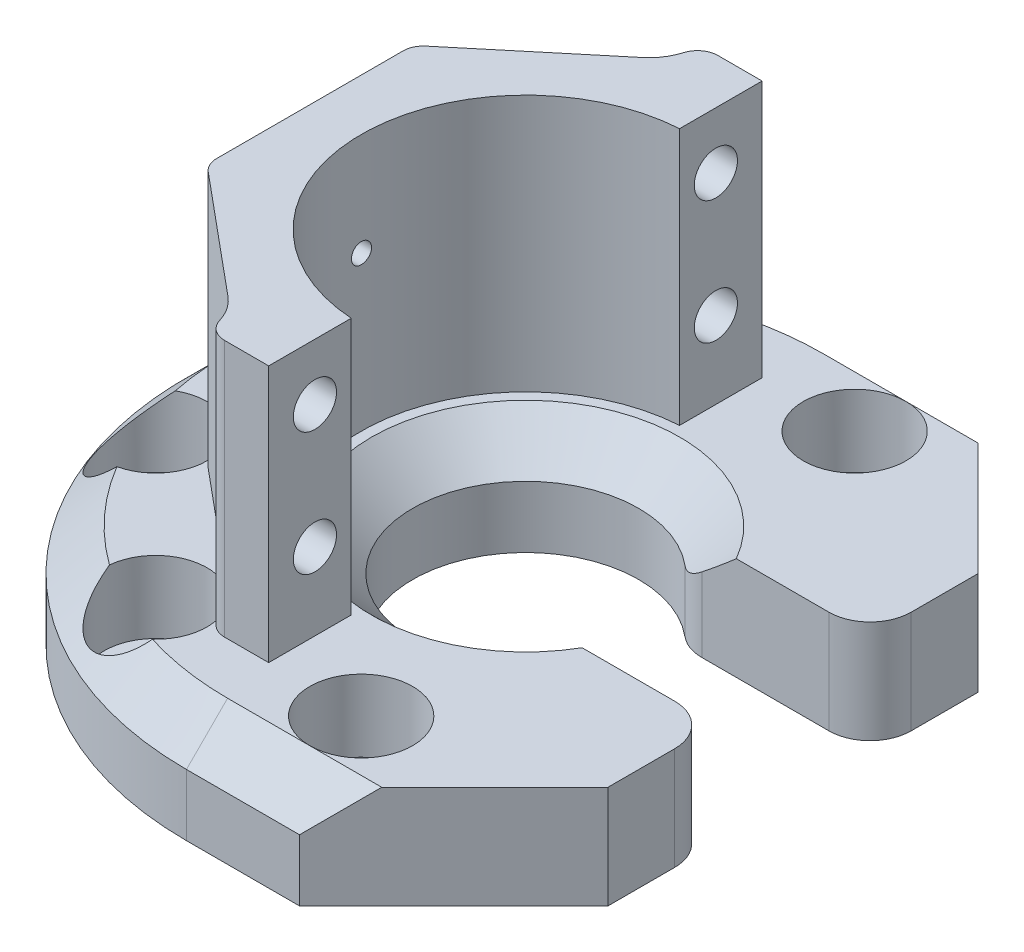
from build123d import *
from build123d.topology import SkipClean

# Parameters (mm, degrees)
SKETCH1_R                      = 33
BOSS_EXTRUDE1_DEPTH            = 5
SKETCH2_R                      = 11
CUT_EXTRUDE1_DEPTH             = 48.728398255
BOSS_EXTRUDE4_DEPTH            = 10
CHAMFER1_SIZE                  = 4
CBORE_FOR_M5_SHCS1_D           = 5.3
CBORE_FOR_M5_SHCS1_CBORE_D     = 10
CBORE_FOR_M5_SHCS1_CBORE_DEPTH = 7
CUT_EXTRUDE12_DEPTH            = 48.728398393
SKETCH43_W                     = 35.90652306
SKETCH43_H                     = 15
CUT_EXTRUDE13_DEPTH            = 48.728398393
FILLET1_R                      = 4
BOSS_EXTRUDE5_START            = 25
BOSS_EXTRUDE5_DEPTH            = 25
SKETCH45_W                     = 4.982753492
SKETCH45_H                     = 25
SKETCH45_W_2                   = 5
CUT_EXTRUDE14_DEPTH            = 55.89080086
FILLET2_R                      = 2
M5X0_8_TAPPED_HOLE1_D          = 4.2
SKETCH48_R                     = 0.975
CUT_EXTRUDE15_DEPTH            = 56.4797262


with BuildPart() as part:
    # Sketch1 → Boss-Extrude1 (new, symmetric)
    with BuildSketch(Plane(origin=(0, 0, 0), x_dir=(1, 0, 0), z_dir=(0, 1, 0))):
        with Locations(Location((0, 0, 0), (0, 0, 270))):
            Circle(SKETCH1_R)
    extrude(amount=BOSS_EXTRUDE1_DEPTH, both=True)

    # Sketch2 → Cut-Extrude1 (cut, through all)
    with BuildSketch(Plane(origin=(0, 5, 0), x_dir=(1, 0, 0), z_dir=(0, 1, 0))):
        with Locations(Location((0, 0, 0), (0, 0, 270))):
            Circle(SKETCH2_R)
    extrude(amount=-CUT_EXTRUDE1_DEPTH, mode=Mode.SUBTRACT)

    # Sketch12 → Boss-Extrude4 (add, through all)
    with BuildSketch(Plane(origin=(0, 5, 0), x_dir=(1, 0, 0), z_dir=(0, 1, 0))):
        with BuildLine():
            Line((0, -33), (33, -33))
            Line((33, -33), (33, 33))
            Line((33, 33), (0, 33))
            Line((0, 33), (0, 16))
            ThreePointArc((0, 16), (16, 0), (0, -16))
            Line((0, -16), (0, -33))
        make_face()
    extrude(amount=-BOSS_EXTRUDE4_DEPTH)

    # Chamfer1
    chamfer1_edges = [part.edges().sort_by_distance(p)[0] for p in [
        (-33, 5, 0),
        (16.5, 5, -33),
        (16.5, 5, 33),
        (0, 5, -11),
    ]]
    chamfer(chamfer1_edges, length=CHAMFER1_SIZE)

    # CBORE for M5 SHCS1 (through all)
    with Locations(Plane(origin=(0, 5, 0), x_dir=(1, 0, 0), z_dir=(0, 1, 0))):
        with Locations((-12, 24), (8, 24), (-26, 10)):
            cbore_for_m5_shcs1 = CounterBoreHole(CBORE_FOR_M5_SHCS1_D / 2, CBORE_FOR_M5_SHCS1_CBORE_D / 2, CBORE_FOR_M5_SHCS1_CBORE_DEPTH)

    # Mirror2: CBORE for M5 SHCS1 across plane
    add(cbore_for_m5_shcs1.mirror(Plane.XY), mode=Mode.SUBTRACT)

    # Sketch40 → Cut-Extrude12 (cut, through all)
    with BuildSketch(Plane(origin=(0, 5, 0), x_dir=(1, 0, 0), z_dir=(0, 1, 0))):
        Polygon((11, 33), (26, 18), (26, -18), (11, -33), (33, -33), (33, 33), align=None)
    extrude(amount=-CUT_EXTRUDE12_DEPTH, mode=Mode.SUBTRACT)

    # Sketch43 → Cut-Extrude13 (cut, through all)
    with BuildSketch(Plane(origin=(0, 5, 0), x_dir=(1, 0, 0), z_dir=(0, 1, 0))):
        with Locations((26, 0)):
            Rectangle(SKETCH43_W, SKETCH43_H)
    extrude(amount=-CUT_EXTRUDE13_DEPTH, mode=Mode.SUBTRACT)

    # Fillet1
    fillet1_edges = [part.edges().sort_by_distance(p)[0] for p in [
        (26, 0, 7.5),
        (26, 0, -7.5),
        (8.04673847, -2, 7.5),
        (8.04673847, -2, -7.5),
    ]]
    fillet(fillet1_edges, radius=FILLET1_R)

    # Sketch44 → Boss-Extrude5 (add)
    with BuildSketch(Plane(origin=(0, 5, 0), x_dir=(1, 0, 0), z_dir=(0, 1, 0)).offset(BOSS_EXTRUDE5_START)):
        with BuildLine():
            Line((-21, 10), (-21, -10))
            Line((-21, -10), (-8.800665882, -20.157570924))
            ThreePointArc((-8.800665882, -20.157570924), (-7.001377279, -23.882650545), (-8.623877396, -27.688061302))
            ThreePointArc((-8.623877396, -27.688061302), (-4.855286912, -28.590666117), (-1, -28.982753492))
            Line((-1, -28.982753492), (-1, -15.968719423))
            ThreePointArc((-1, -15.968719423), (-16, 0), (-1, 15.968719423))
            Line((-1, 15.968719423), (-1, 28.982753492))
            ThreePointArc((-1, 28.982753492), (-4.855286912, 28.590666117), (-8.623877396, 27.688061302))
            ThreePointArc((-8.623877396, 27.688061302), (-7.001377279, 23.882650545), (-8.800665882, 20.157570924))
            Line((-8.800665882, 20.157570924), (-21, 10))
        make_face()
    extrude(amount=-BOSS_EXTRUDE5_DEPTH)

    # Sketch45 → Cut-Extrude14 (cut, through all)
    with SkipClean():  # the faces are left unmerged after this step: merging them gives an invalid solid
        with BuildSketch(Plane(origin=(-1, 0, 0), x_dir=(0, 0, -1), z_dir=(1, 0, 0))):
            with Locations((-26.491376746, 17.5)):
                Rectangle(SKETCH45_W, SKETCH45_H)
            with Locations((26.5, 17.5)):
                Rectangle(SKETCH45_W_2, SKETCH45_H)
        extrude(amount=-CUT_EXTRUDE14_DEPTH, mode=Mode.SUBTRACT)

    # Fillet2
    # the kernel refuses this fillet: 2 mm, written as the material it takes off along each edge
    with BuildSketch(Plane(origin=(-21, 32.343134833, -10), x_dir=(0.7684858151533847, 0, -0.6398668235719351), z_dir=(0, -1, 0)), Plane(origin=(-21, 32.343134833, 10), x_dir=(0, 0, -1), z_dir=(0, -1, 0))) as fillet2_piece_1:
        with BuildLine():
            CenterArc((FILLET2_R * 0.468626966597, FILLET2_R), FILLET2_R, 219.781889586, 50.218110414)
            Line((-FILLET2_R * 0.299858848557, FILLET2_R * 0.360133176428), (0, 0))
            Line((0, 0), (FILLET2_R * 0.468626966597, 0))
        make_face()
    extrude(amount=27.343134833, mode=Mode.SUBTRACT)
    with BuildSketch(Plane(origin=(-7, 5, 24), x_dir=(1, 0, 0), z_dir=(0, 1, 0))) as fillet2_piece_2:
        with BuildLine():
            CenterArc((1.708203932, 2), FILLET2_R, 196.601549599, 73.398450401)
            ThreePointArc((-0.208425763, 1.428571429), (-0.052380816, 0.721847911), (0, 0))
            Line((0, 0), (1.708203932, 0))
        make_face()
    extrude(amount=29.270509831, mode=Mode.SUBTRACT)
    with BuildSketch(Plane(origin=(-7, 5, -24), x_dir=(-0.1443695821495722, 0, 0.9895238368781006), z_dir=(0, 1, 0))) as fillet2_piece_3:
        with BuildLine():
            CenterArc((1.732434986, 1.979047674), FILLET2_R, 188.300774799, 73.398450401)
            Line((-0.246612688, 1.690308509), (0, 0))
            ThreePointArc((0, 0), (0.721847911, 0.052380816), (1.443695821, 0))
        make_face()
    extrude(amount=29.270509831, mode=Mode.SUBTRACT)

    # M5x0.8 Tapped Hole1 (through all)
    with Locations(Plane(origin=(-1, 0, 0), x_dir=(0, 0, -1), z_dir=(1, 0, 0))):
        with Locations((-19.5, 24.5), (-19.5, 12.5), (19.5, 12.5), (19.5, 24.5)):
            Hole(M5X0_8_TAPPED_HOLE1_D / 2)

    # Sketch48 → Cut-Extrude15 (cut, through all)
    with BuildSketch(Plane.ZY):
        with Locations(Location((0, 20, 0), (0, 0, 180))):
            Circle(SKETCH48_R)
    extrude(amount=CUT_EXTRUDE15_DEPTH, mode=Mode.SUBTRACT)


solid = part.part
